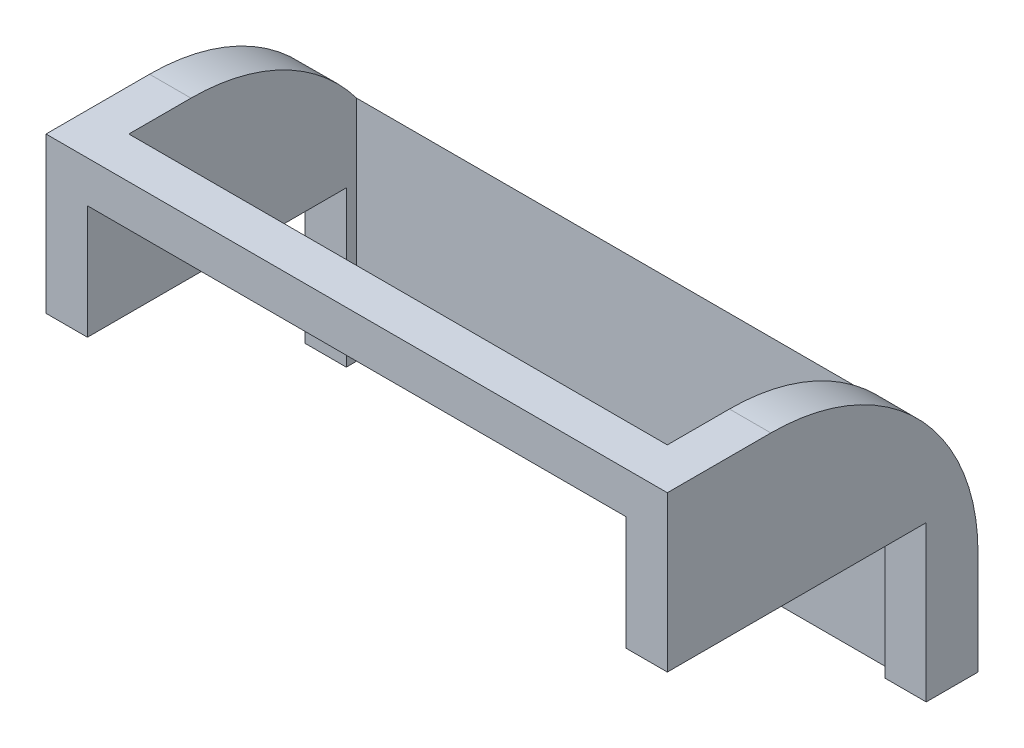
from build123d import *

# Parameters (mm, degrees)
SKETCH12_W               = 30
SKETCH12_H               = 15
BOSS_EXTRUDE4_DEPTH      = 15
FILLET1_R                = 10
CUT_EXTRUDE8_DEPTH       = 23.5
CUT_EXTRUDE8_DEPTH_BACK  = 23.5
SKETCH13_W               = 26
SKETCH13_H               = 11
SKETCH14_W               = 26
SKETCH14_H               = 11
CUT_EXTRUDE9_DEPTH       = 10
CUT_EXTRUDE10_DEPTH      = 35.369317712
CUT_EXTRUDE10_DEPTH_BACK = 35.369317712
SKETCH15_W               = 12.5
SKETCH15_H               = 7.5
SCALE1_SCALE             = 6


with BuildPart() as part:
    # Sketch12 → Boss-Extrude4 (new body)
    with BuildSketch(Plane(origin=(0, 0, 0), x_dir=(1, 0, 0), z_dir=(0, 1, 0))):
        Rectangle(SKETCH12_W, SKETCH12_H)
    extrude(amount=BOSS_EXTRUDE4_DEPTH)

    # Fillet1
    fillet1_edges = [part.edges().sort_by_distance(p)[0] for p in [
        (0, 15, -7.5),
    ]]
    fillet(fillet1_edges, radius=FILLET1_R)

    # Sketch13 → Cut-Extrude8 (cut, two sides: drawn at the far end of the back side and taken through both)
    with BuildSketch(Plane.XZ.offset(-CUT_EXTRUDE8_DEPTH_BACK)):
        Rectangle(SKETCH13_W, SKETCH13_H)
    extrude(amount=CUT_EXTRUDE8_DEPTH + CUT_EXTRUDE8_DEPTH_BACK, mode=Mode.SUBTRACT)

    # Sketch14 → Cut-Extrude9 (cut)
    with BuildSketch(Plane.XY.offset(7.5)):
        with Locations((0, 7.5)):
            Rectangle(SKETCH14_W, SKETCH14_H)
    extrude(amount=-CUT_EXTRUDE9_DEPTH, mode=Mode.SUBTRACT)

    # Sketch15 → Cut-Extrude10 (cut, two sides: drawn at the far end of the back side and taken through both)
    with BuildSketch(Plane(origin=(15, 0, 0), x_dir=(0, 0, -1), z_dir=(1, 0, 0)).offset(-CUT_EXTRUDE10_DEPTH_BACK)):
        with Locations((-1.25, 3.75)):
            Rectangle(SKETCH15_W, SKETCH15_H)
    extrude(amount=CUT_EXTRUDE10_DEPTH + CUT_EXTRUDE10_DEPTH_BACK, mode=Mode.SUBTRACT)


with BuildPart() as part_1:
    # Scale1: scaled about (0, 7.779744909, -2.334627912)
    add(part.part.scale(SCALE1_SCALE).moved(Location((0, -38.898724545, 11.67313956))))


solid = part_1.part
